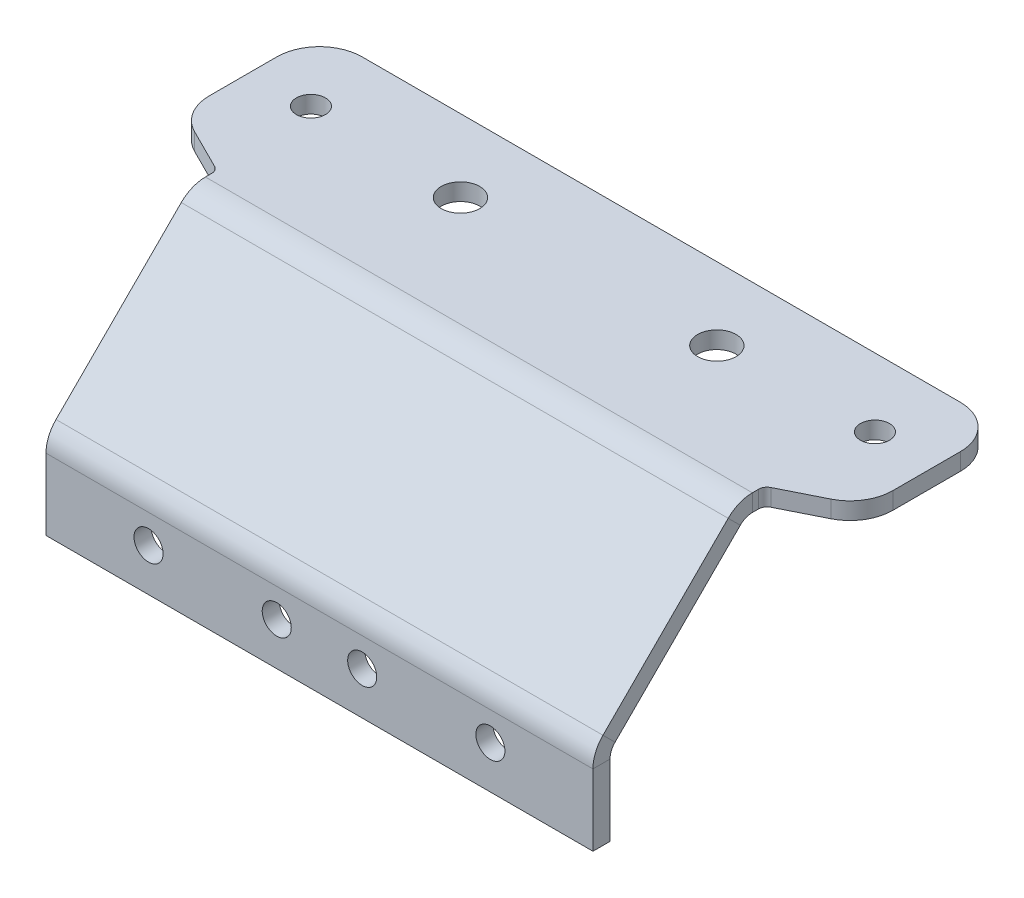
from build123d import *

# Parameters (mm, degrees)
BASE_FLANGE1_DEPTH       = 80
CUT_EXTRUDE1_DEPTH       = 94.429117517
M3_CLEARANCE_HOLE1_D     = 3.4
M3_CLEARANCE_HOLE1_DEPTH = 2
M3_CLEARANCE_HOLE1_TIP   = 1.021463052
M4_CLEARANCE_HOLE1_D     = 4.5
M4_CLEARANCE_HOLE1_DEPTH = 2
M4_CLEARANCE_HOLE1_TIP   = 1.351936393
M3_CLEARANCE_HOLE2_D     = 3.4
M3_CLEARANCE_HOLE2_DEPTH = 2
M3_CLEARANCE_HOLE2_TIP   = 1.021463052
FILLET1_R                = 5
FILLET2_R                = 1


# Sheet-metal steps are written as plain solids
with BuildPart() as part:
    # Sketch1 → Base-Flange1 (new body)
    with BuildSketch(Plane(origin=(0, 0, 0), x_dir=(0, 0, -1), z_dir=(1, 0, 0))):
        with BuildLine():
            Line((0, 0), (0, 8.343145751))
            ThreePointArc((0, 8.343145751), (0.30448187, 9.87387948), (1.171572875, 11.171572875))
            Line((1.171572875, 11.171572875), (15.828427125, 25.828427125))
            ThreePointArc((15.828427125, 25.828427125), (17.12612052, 26.69551813), (18.656854249, 27))
            Line((18.656854249, 27), (40, 27))
            Line((40, 27), (40, 25))
            Line((40, 25), (18.656854249, 25))
            ThreePointArc((18.656854249, 25), (17.891487385, 24.847759065), (17.242640687, 24.414213562))
            Line((17.242640687, 24.414213562), (2.585786438, 9.757359313))
            ThreePointArc((2.585786438, 9.757359313), (2.152240935, 9.108512615), (2, 8.343145751))
            Line((2, 8.343145751), (2, 0))
            Line((2, 0), (0, 0))
        make_face()
    extrude(amount=BASE_FLANGE1_DEPTH)

    # Sketch2 → Cut-Extrude1 (cut, through all)
    with BuildSketch(Plane(origin=(0, 27, 0), x_dir=(1, 0, 0), z_dir=(0, 1, 0))):
        Polygon((0, 24), (8, 20), (8, 0), (0, 0), align=None)
        Polygon((80, 0), (80, 24), (72, 20), (72, 0), align=None)
    extrude(amount=-CUT_EXTRUDE1_DEPTH, mode=Mode.SUBTRACT)

    # M3 Clearance Hole1
    with Locations(Plane.XY):
        with Locations((20, 5), (35, 5), (45, 5), (60, 5)):
            Hole(M3_CLEARANCE_HOLE1_D / 2, depth=M3_CLEARANCE_HOLE1_DEPTH)
            with Locations((0, 0, -(M3_CLEARANCE_HOLE1_DEPTH + M3_CLEARANCE_HOLE1_TIP / 2))):  # 118° drill point
                Cone(0, M3_CLEARANCE_HOLE1_D / 2, M3_CLEARANCE_HOLE1_TIP, mode=Mode.SUBTRACT)

    # M4 Clearance Hole1
    with Locations(Plane(origin=(0, 27, 0), x_dir=(1, 0, 0), z_dir=(0, 1, 0))):
        with Locations((25, 31.5), (55, 31.5)):
            Hole(M4_CLEARANCE_HOLE1_D / 2, depth=M4_CLEARANCE_HOLE1_DEPTH)
            with Locations((0, 0, -(M4_CLEARANCE_HOLE1_DEPTH + M4_CLEARANCE_HOLE1_TIP / 2))):  # 118° drill point
                Cone(0, M4_CLEARANCE_HOLE1_D / 2, M4_CLEARANCE_HOLE1_TIP, mode=Mode.SUBTRACT)

    # M3 Clearance Hole2
    with Locations(Plane(origin=(0, 27, 0), x_dir=(1, 0, 0), z_dir=(0, 1, 0))):
        with Locations((7, 32), (73, 32)):
            Hole(M3_CLEARANCE_HOLE2_D / 2, depth=M3_CLEARANCE_HOLE2_DEPTH)
            with Locations((0, 0, -(M3_CLEARANCE_HOLE2_DEPTH + M3_CLEARANCE_HOLE2_TIP / 2))):  # 118° drill point
                Cone(0, M3_CLEARANCE_HOLE2_D / 2, M3_CLEARANCE_HOLE2_TIP, mode=Mode.SUBTRACT)

    # Fillet1
    fillet1_edges = [part.edges().sort_by_distance(p)[0] for p in [
        (0, 26, -40),
        (80, 26, -24),
        (80, 26, -40),
        (0, 26, -24),
    ]]
    fillet(fillet1_edges, radius=FILLET1_R)

    # Fillet2
    fillet2_edges = [part.edges().sort_by_distance(p)[0] for p in [
        (72, 26, -20),
        (8, 26, -20),
    ]]
    fillet(fillet2_edges, radius=FILLET2_R)


solid = part.part
